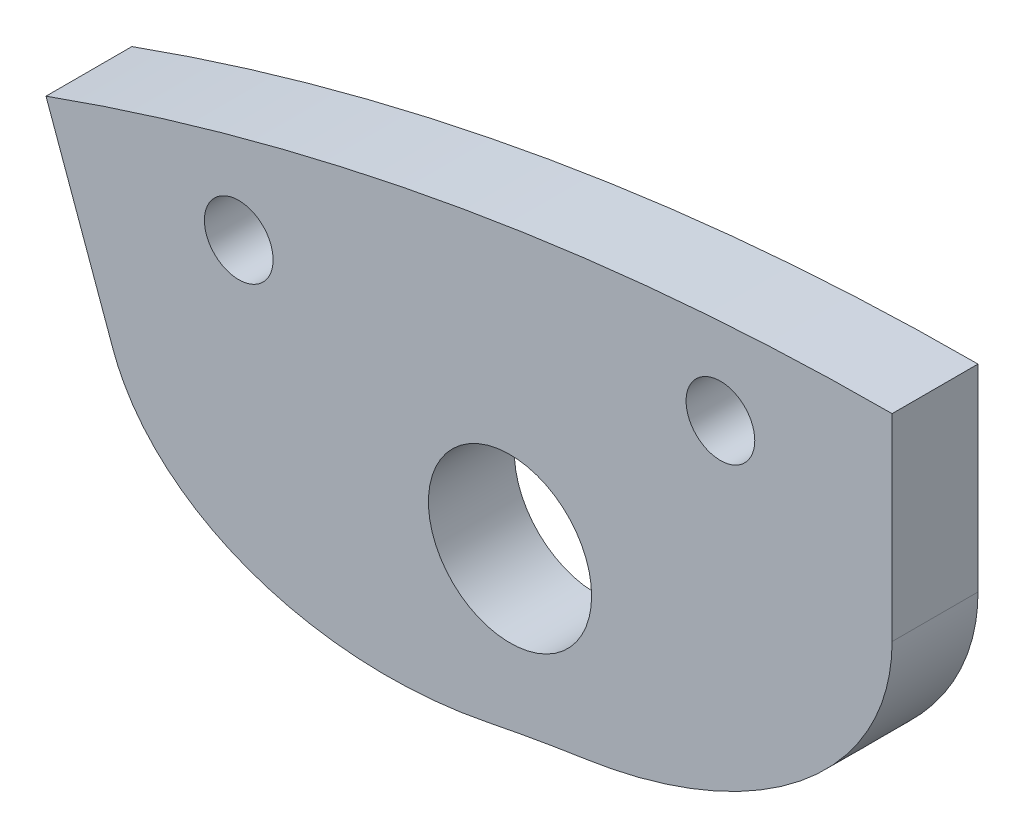
from build123d import *

# Parameters (mm, degrees)
ESTRUSIONE_ESTRUSIONE1_DEPTH = 5
SCHIZZO2_R                   = 2
TAGLIO_ESTRUSIONE1_DEPTH     = 5
SCHIZZO4_R                   = 4.75
TAGLIO_ESTRUSIONE2_DEPTH     = 10


with BuildPart() as part:
    # Schizzo1 → Estrusione-Estrusione1 (new body)
    with BuildSketch(Plane.XY):
        with BuildLine():
            Line((0, 145), (0, 120))
            ThreePointArc((0, 120), (-20.689655172, 118.2029533), (-40.759639069, 112.865636147))
            Line((-40.759639069, 112.865636147), (-49.251230542, 136.379310345))
            ThreePointArc((-49.251230542, 136.379310345), (-25, 142.828568571), (0, 145))
        make_face()
    extrude(amount=ESTRUSIONE_ESTRUSIONE1_DEPTH)

    # Schizzo2 → Taglio-Estrusione1 (cut)
    with BuildSketch(Plane.XY.offset(5)):
        with Locations((-38.032134419, 134.73513555)):
            Circle(SCHIZZO2_R)
        with Locations((-9.993620414, 139.642857143)):
            Circle(SCHIZZO2_R)
    extrude(amount=-TAGLIO_ESTRUSIONE1_DEPTH, mode=Mode.SUBTRACT)

    # Raccordo1
    # an asymmetric fillet: 20, 15 mm, written as the material it takes off along each edge
    with BuildSketch(Plane(origin=(-40.759639069, 112.865636147, -44.567563269), x_dir=(-0.3396636589081028, 0.9405469678953624, 0), z_dir=(0, 0, 1))) as raccordo1_piece_1:
        with BuildLine():
            Bezier((13.510299228, 0), (1.338953576, 0), (-1.324178464, -17.777777778), weights=[1, 0.757676761, 1])
            ThreePointArc((-1.324178464, -17.777777778), (-0.331502507, -8.913512654), (0, 0))
            Line((0, 0), (13.510299228, 0))
        make_face()
    extrude(amount=94.135126538, mode=Mode.SUBTRACT)

    # Raccordo2
    # an asymmetric fillet: 20, 15 mm, written as the material it takes off along each edge
    with BuildSketch(Plane(origin=(0, 120, -44.567563269), x_dir=(-0.9972374791061684, -0.07427927211527091, 0), z_dir=(0, 0, 1))) as raccordo2_piece_1:
        with BuildLine():
            Bezier((17.827025308, 0), (-0.099456497, -1.335254689), (-1.003535193, -13.472976744), weights=[1, 0.757676761, 1])
            Line((-1.003535193, -13.472976744), (0, 0))
            ThreePointArc((0, 0), (8.913512654, -0.331502507), (17.827025308, 0))
        make_face()
    extrude(amount=94.135126538, mode=Mode.SUBTRACT)

    # Schizzo4 → Taglio-Estrusione2 (cut)
    with BuildSketch(Plane.XY.offset(5)):
        with Locations((-22.24137931, 127.068174798)):
            Circle(SCHIZZO4_R)
    extrude(amount=-TAGLIO_ESTRUSIONE2_DEPTH, mode=Mode.SUBTRACT)


solid = part.part
